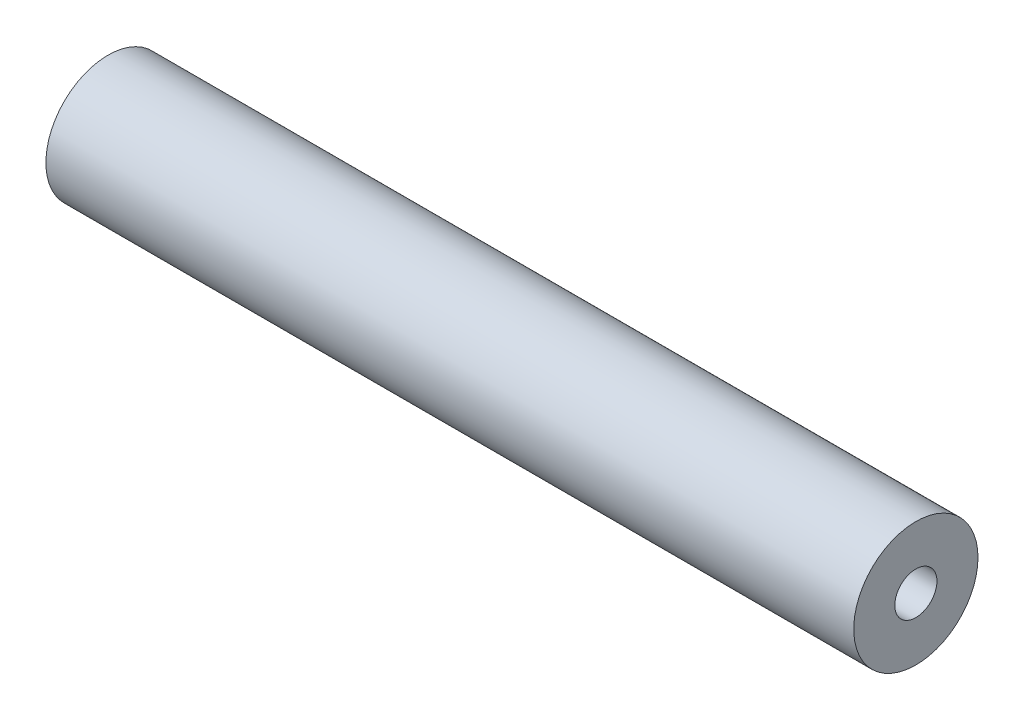
from build123d import *

# Parameters (mm, degrees)
SKETCH1_R           = 6.35
SKETCH1_R_2         = 2.15265
BOSS_EXTRUDE1_DEPTH = 82.55


with BuildPart() as part:
    # Sketch1 → Boss-Extrude1 (new body)
    with BuildSketch(Plane(origin=(0, 0, 0), x_dir=(0, 0, -1), z_dir=(1, 0, 0))):
        Circle(SKETCH1_R)
        Circle(SKETCH1_R_2, mode=Mode.SUBTRACT)
    extrude(amount=BOSS_EXTRUDE1_DEPTH)


solid = part.part
